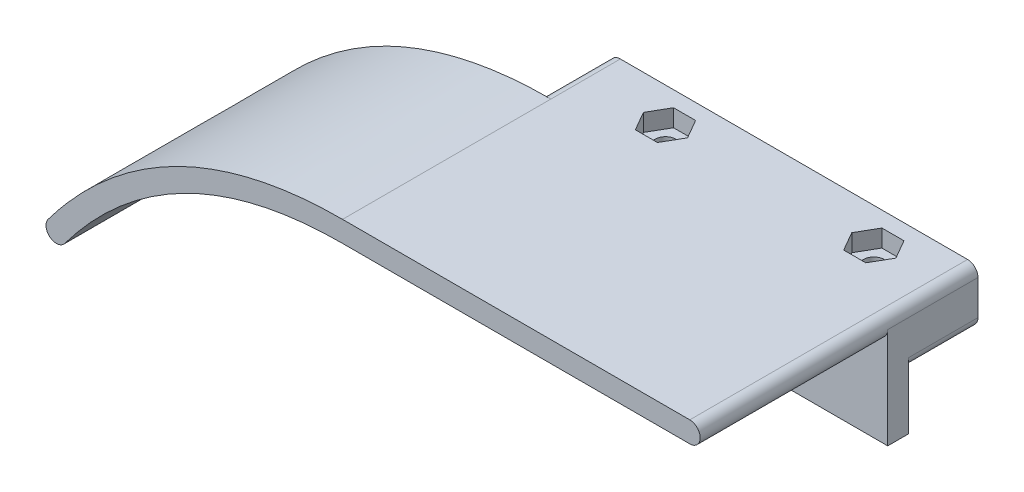
from build123d import *

# Parameters (mm, degrees)
EXTRUDE_1_DEPTH     = 30
EXTRUDE_2_DEPTH     = 3
EXTRUDE_START       = 10
EXTRUDE_3_DEPTH     = 10
SKETCH_4_R          = 1.5
CUT_EXTRUDE_1_DEPTH = 78.719045441
CUT_EXTRUDE_2_DEPTH = 78.27677545
CUT_EXTRUDE_START   = -2.5
CUT_EXTRUDE_3_DEPTH = 81.219045441
FILLET_1_R          = 2


with BuildPart() as part:
    # 草图1 → 凸台-拉伸1 (new body)
    with BuildSketch(Plane.XY):
        with BuildLine():
            Line((-25, -1.5), (25, -1.5))
            ThreePointArc((25, -1.5), (26.5, 0), (25, 1.5))
            Line((25, 1.5), (-25, 1.5))
            add(Edge.make_bspline(
                [(-25, 1.5), (-34.841235479, 1.511543442), (-49.008834865, -3.48233027), (-61.504493466, -11.820085551), (-67.4, -19.7)],
                knots=[0, 0, 0, 0.375, 0.625, 1, 1, 1], degree=2))
            ThreePointArc((-67.4, -19.7), (-67.1, -21.8), (-65, -21.5))
            add(Edge.make_bspline(
                [(-25, -1.5), (-50, -1.5), (-65, -21.5)],
                knots=[0, 0, 0, 1, 1, 1], degree=2))
        make_face()
    extrude(amount=EXTRUDE_1_DEPTH)

    # 草图2 → 凸台-拉伸2 (add)
    with BuildSketch(Plane(origin=(0, 0, 0), x_dir=(-1, 0, 0), z_dir=(0, 0, -1))):
        with BuildLine():
            Line((25, 1.5), (-25, 1.5))
            ThreePointArc((-25, 1.5), (-26.060660172, 1.060660172), (-26.5, 0))
            Line((-26.5, 0), (-26.5, -22.1))
            Line((-26.5, -22.1), (66.2, -22.1))
            ThreePointArc((66.2, -22.1), (67.541640786, -21.270820393), (67.4, -19.7))
            add(Edge.make_bspline(
                [(25, 1.5), (34.841235479, 1.511543442), (49.008834865, -3.48233027), (61.504493466, -11.820085551), (67.4, -19.7)],
                knots=[0, 0, 0, 0.375, 0.625, 1, 1, 1], degree=2))
        make_face()
    extrude(amount=-EXTRUDE_2_DEPTH)

    # 草图3 → 凸台-拉伸3 (add)
    with BuildSketch(Plane(origin=(0, 0, 0), x_dir=(-1, 0, 0), z_dir=(0, 0, -1)).offset(EXTRUDE_START)):
        with BuildLine():
            Line((-25, 1.5), (25, 1.5))
            ThreePointArc((25, 1.5), (26.060660172, 1.060660172), (26.5, 0))
            Line((26.5, 0), (26.5, -5))
            ThreePointArc((26.5, -5), (26.060660172, -6.060660172), (25, -6.5))
            Line((25, -6.5), (-25, -6.5))
            ThreePointArc((-25, -6.5), (-26.060660172, -6.060660172), (-26.5, -5))
            Line((-26.5, -5), (-26.5, 0))
            ThreePointArc((-26.5, 0), (-26.060660172, 1.060660172), (-25, 1.5))
        make_face()
    extrude(amount=-EXTRUDE_3_DEPTH)

    # 草图4 → 切除-拉伸1 (cut, through all)
    with BuildSketch(Plane(origin=(0, 1.5, 0), x_dir=(1, 0, 0), z_dir=(0, 1, 0))):
        with Locations((-13.5, 5)):
            Circle(SKETCH_4_R)
        with Locations((16.5, 5)):
            Circle(SKETCH_4_R)
    extrude(amount=-CUT_EXTRUDE_1_DEPTH, mode=Mode.SUBTRACT)

    # 草图5 → 切除-拉伸2 (cut, through all)
    with BuildSketch(Plane(origin=(0, 0, 0), x_dir=(-1, 0, 0), z_dir=(0, 0, -1))):
        with BuildLine():
            Line((-26.5, -14.5), (33.5, -14.5))
            ThreePointArc((33.5, -14.5), (38.874011537, -16.725988463), (41.1, -22.1))
            Line((41.1, -22.1), (-26.5, -22.1))
            Line((-26.5, -22.1), (-26.5, -14.5))
        make_face()
    extrude(amount=-CUT_EXTRUDE_2_DEPTH, mode=Mode.SUBTRACT)

    # 草图6 → 切除-拉伸3 (cut, through all)
    with BuildSketch(Plane(origin=(0, 1.5, 0), x_dir=(1, 0, 0), z_dir=(0, 1, 0)).offset(CUT_EXTRUDE_START)):
        Polygon((-11.91228676, 7.75), (-15.08771324, 7.75), (-16.675426481, 5), (-15.08771324, 2.25), (-11.91228676, 2.25), (-10.324573519, 5), align=None)
        Polygon((18.08771324, 7.75), (14.91228676, 7.75), (13.324573519, 5), (14.91228676, 2.25), (18.08771324, 2.25), (19.675426481, 5), align=None)
    extrude(amount=CUT_EXTRUDE_3_DEPTH, mode=Mode.SUBTRACT)

    # 圆角1
    fillet_1_edges = [part.edges().sort_by_distance(p)[0] for p in [
        (-41.1, -22.1, 1.5),
    ]]
    fillet(fillet_1_edges, radius=FILLET_1_R)


solid = part.part
